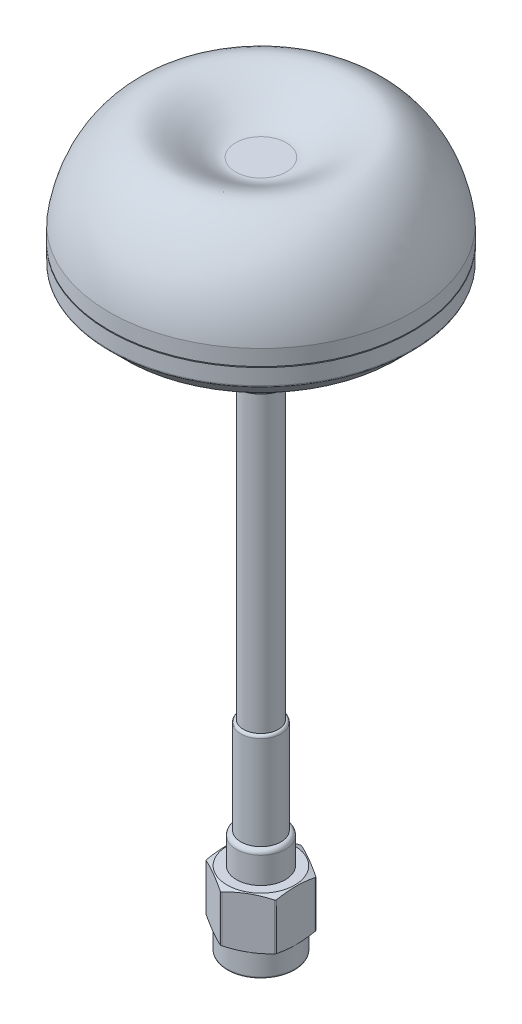
from build123d import *

# Parameters (mm, degrees)
SKETCH1_R           = 3.88
BOSS_EXTRUDE1_DEPTH = 2.6
BOSS_EXTRUDE2_DEPTH = 5.9
SKETCH3_R           = 3.25
CUT_EXTRUDE1_DEPTH  = 1
SKETCH4_R           = 2.85
SKETCH4_R_2         = 0.475
CUT_EXTRUDE2_DEPTH  = 2.45
SKETCH5_R           = 2.85
SKETCH5_R_2         = 2.6
CUT_EXTRUDE3_DEPTH  = 4
SKETCH6_R           = 2.5
SKETCH6_R_2         = 0.475
CUT_EXTRUDE4_DEPTH  = 0.1
THREAD1_PITCH       = 1
CHAMFER1_SIZE       = 1
CHAMFER1_SIZE2      = 0.363970234
FILLET1_R           = 0.2
SKETCH11_R          = 2.8
BOSS_EXTRUDE3_DEPTH = 3.5
SKETCH12_R          = 2.3
BOSS_EXTRUDE4_DEPTH = 11
SKETCH13_R          = 2
BOSS_EXTRUDE6_DEPTH = 34.5
FILLET2_R           = 0.5
FILLET3_R           = 0.3
FILLET4_R           = 3
FILLET5_R           = 0.25
SKETCH16_W          = 0.2
SKETCH16_H          = 0.1


# Some blends are built 0.0001 mm under size
with BuildPart() as part:
    # Sketch1 → Boss-Extrude1 (new body)
    with BuildSketch(Plane(origin=(0, 0, 0), x_dir=(1, 0, 0), z_dir=(0, 1, 0))):
        with Locations(Location((0, 0, 0), (0, 0, 270))):
            Circle(SKETCH1_R)
    extrude(amount=BOSS_EXTRUDE1_DEPTH)

    # Sketch2 → Boss-Extrude2 (add)
    with BuildSketch(Plane(origin=(0, 2.6, 0), x_dir=(1, 0, 0), z_dir=(0, 1, 0))):
        Polygon((0, -4.618802154), (4, -2.309401077), (4, 2.309401077), (0, 4.618802154), (-4, 2.309401077), (-4, -2.309401077), align=None)
    extrude(amount=BOSS_EXTRUDE2_DEPTH)

    # Sketch3 → Cut-Extrude1 (cut)
    with BuildSketch(Plane.XZ):
        with Locations(Location((0, 0, 0), (0, 0, 270))):
            Circle(SKETCH3_R)
    extrude(amount=-CUT_EXTRUDE1_DEPTH, mode=Mode.SUBTRACT)

    # Sketch4 → Cut-Extrude2 (cut)
    with BuildSketch(Plane.XZ.offset(-1)):
        with Locations(Location((0, 0, 0), (0, 0, 270))):
            Circle(SKETCH4_R)
        with Locations(Location((0, 0, 0), (0, 0, 270))):
            Circle(SKETCH4_R_2, mode=Mode.SUBTRACT)
    extrude(amount=-CUT_EXTRUDE2_DEPTH, mode=Mode.SUBTRACT)

    # Sketch5 → Cut-Extrude3 (cut)
    with BuildSketch(Plane.XZ.offset(-3.45)):
        with Locations(Location((0, 0, 0), (0, 0, 270))):
            Circle(SKETCH5_R)
        with Locations(Location((0, 0, 0), (0, 0, 270))):
            Circle(SKETCH5_R_2, mode=Mode.SUBTRACT)
    extrude(amount=-CUT_EXTRUDE3_DEPTH, mode=Mode.SUBTRACT)

    # Sketch6 → Cut-Extrude4 (cut)
    with BuildSketch(Plane.XZ.offset(-3.45)):
        with Locations(Location((0, 0, 0), (0, 0, 270))):
            Circle(SKETCH6_R)
        with Locations(Location((0, 0, 0), (0, 0, 270))):
            Circle(SKETCH6_R_2, mode=Mode.SUBTRACT)
    extrude(amount=-CUT_EXTRUDE4_DEPTH, mode=Mode.SUBTRACT)

    # Thread1: the profile of Thread Profile1 profile screwed along a right-hand helix of 7.45 turns, 8 arcs to a turn; built about Z, then put on its axis
    thread1_z = Axis((0, 0, 0), (0, 0, 1))
    thread1_corners = [(2.8497, 0, -0.000173205), (3.391265875, 0, 0.312499999), (3.391265875, 0, 0.437499999), (2.8497, 0, 0.750173202)]
    with BuildLine(mode=Mode.PRIVATE) as thread1_profile:
        Line(thread1_corners[0], thread1_corners[1])
        Line(thread1_corners[1], thread1_corners[2])
        Line(thread1_corners[2], thread1_corners[3])
        Line(thread1_corners[3], thread1_corners[0])
    thread1_cap = Face(thread1_profile.wire())
    thread1_turn_angles = [0, 22.5, 45, 67.5, 90, 112.5, 135, 157.5, 180, 202.5, 225, 247.5, 270, 292.5, 315, 337.5, 360]
    thread1_turn_weights = [1, 0.9238795325112867, 1, 0.9238795325112867, 1, 0.9238795325112867, 1, 0.9238795325112867, 1, 0.9238795325112867, 1, 0.9238795325112867, 1, 0.9238795325112867, 1, 0.9238795325112867, 1]
    thread1_turn_rails = [Edge.make_bspline([Vector(p[0], p[1], 0).rotate(thread1_z, thread1_turn_angles[k]) / thread1_turn_weights[k] + Vector(0, 0, p[2] + THREAD1_PITCH * thread1_turn_angles[k] / 360) for k in range(17)], [0, 0, 0, 1, 1, 2, 2, 3, 3, 4, 4, 5, 5, 6, 6, 7, 7, 8, 8, 8], 2, thread1_turn_weights) for p in thread1_corners]
    thread1_turn_sides = [Face.make_surface_from_curves(thread1_turn_rails[p[0]], thread1_turn_rails[p[1]]) for p in [(0, 1), (1, 2), (2, 3), (3, 0)]]
    thread1_last_angles = [2520, 2542.5, 2565, 2587.5, 2610, 2632.5, 2655, 2668.5, 2682]
    thread1_last_weights = [1, 0.9238795325112867, 1, 0.9238795325112867, 1, 0.9238795325112867, 1, 0.9723699203976766, 1]
    thread1_last_rails = [Edge.make_bspline([Vector(p[0], p[1], 0).rotate(thread1_z, thread1_last_angles[k]) / thread1_last_weights[k] + Vector(0, 0, p[2] + THREAD1_PITCH * thread1_last_angles[k] / 360) for k in range(9)], [0, 0, 0, 1, 1, 2, 2, 3, 3, 4, 4, 4], 2, thread1_last_weights) for p in thread1_corners]
    thread1_last_sides = [Face.make_surface_from_curves(thread1_last_rails[p[0]], thread1_last_rails[p[1]]) for p in [(0, 1), (1, 2), (2, 3), (3, 0)]]
    thread1 = Plane(origin=(0, 0, 0), x_dir=(1, 0, 0), z_dir=(0, 1, 0)) * Solid(Shell([*[p.moved(Location((0, 0, THREAD1_PITCH * i))) for i in range(7) for p in thread1_turn_sides], *thread1_last_sides, thread1_cap, thread1_cap.rotate(thread1_z, 2682).moved(Location((0, 0, THREAD1_PITCH * 2682 / 360)))]))
    add(thread1, mode=Mode.SUBTRACT)

    # Chamfer1
    chamfer1_edges = [part.edges().sort_by_distance(p)[0] for p in [
        (0, 1, 0.475),
    ]]
    chamfer1_side = [part.faces().sort_by_distance(p)[0] for p in [
        (0, 2.275, 0.475),
    ]]
    chamfer(chamfer1_edges, length=CHAMFER1_SIZE, length2=CHAMFER1_SIZE2, reference=chamfer1_side[0])

    # Sketch10 → Cut-Revolve1 (revolve, cut)
    with BuildSketch(Plane(origin=(0, 0, 0), x_dir=(0.8660254037844387, 0, 0.4999999999999999), z_dir=(-0.4999999999999999, 0, 0.8660254037844387)), mode=Mode.PRIVATE) as cut_revolve1_sk:
        Polygon((-3.868802154, 8.5), (-4.618802154, 8.2), (-4.618802154, 8.5), align=None)
        Polygon((-4.618802154, 2.9), (-4.618802154, 2.6), (-3.868802154, 2.6), align=None)
    revolve(cut_revolve1_sk.sketch.rotate(Axis((0, 2.6, 0), (0, -1, 0)), 60), axis=Axis((0, 2.6, 0), (0, -1, 0)), mode=Mode.SUBTRACT)

    # Fillet1
    # the kernel refuses this fillet: 0.2 mm, written as the material it takes off along each edge
    with BuildSketch(Plane(origin=(4, 2.611324865, -2.309401077), x_dir=(-0.8660254037844374, 0, -0.5000000000000021), z_dir=(0, 1, 0)), Plane(origin=(-4, 2.611324865, -2.309401077), x_dir=(0, 0, 1), z_dir=(0, 1, 0)), Plane(origin=(4, 2.611324865, 2.309401077), x_dir=(0, 0, -1), z_dir=(0, 1, 0)), Plane(origin=(0, 2.611324865, 4.618802154), x_dir=(0.8660254037844397, 0, -0.49999999999999806), z_dir=(0, 1, 0)), Plane(origin=(-4, 2.611324865, 2.309401077), x_dir=(0.8660254037844374, 0, 0.5000000000000021), z_dir=(0, 1, 0))) as fillet1_piece_1:
        with BuildLine():
            CenterArc((FILLET1_R * 0.57735026919, FILLET1_R), FILLET1_R, 210, 60)
            Line((-FILLET1_R * 0.288675134595, FILLET1_R * 0.5), (0, 0))
            Line((0, 0), (FILLET1_R * 0.57735026919, 0))
        make_face()
    extrude(amount=5.877350269, mode=Mode.SUBTRACT)
    with BuildSketch(Plane(origin=(0, 2.611324865, -4.618802154), x_dir=(0.8660254037844368, 0, 0.5000000000000033), z_dir=(0, 1, 0))) as fillet1_piece_2:
        with BuildLine():
            CenterArc((FILLET1_R * 0.57735026919, -FILLET1_R), FILLET1_R, 90, 60)
            Line((-FILLET1_R * 0.288675134595, -FILLET1_R * 0.5), (0, 0))
            Line((0, 0), (FILLET1_R * 0.57735026919, 0))
        make_face()
    extrude(amount=5.877350269, mode=Mode.SUBTRACT)
    with BuildSketch(Plane(origin=(0, 0, 0), x_dir=(0, 0, -1), z_dir=(-1, 0, 0))) as fillet1_piece_3:
        with BuildLine():
            CenterArc((3.25 + FILLET1_R, -FILLET1_R), FILLET1_R, 90, 90)
            Line((3.25 + FILLET1_R, 0), (3.25, 0))
            Line((3.25, 0), (3.25, -FILLET1_R))
        make_face()
    revolve(axis=Axis((0, 0, 0), (0, -1, 0)), mode=Mode.SUBTRACT)
    with BuildSketch(Plane(origin=(0, 0, 0), x_dir=(0, 0, 1), z_dir=(-1, 0, 0))) as fillet1_piece_4:
        with BuildLine():
            CenterArc((3.88 - FILLET1_R, FILLET1_R), FILLET1_R, 270, 90)
            Line((3.88, FILLET1_R), (3.88, 0))
            Line((3.88, 0), (3.88 - FILLET1_R, 0))
        make_face()
    revolve(axis=Axis((0, 0, 0), (0, 1, 0)), mode=Mode.SUBTRACT)

    # Sketch11 → Boss-Extrude3 (add)
    with BuildSketch(Plane(origin=(0, 8.5, 0), x_dir=(1, 0, 0), z_dir=(0, 1, 0))):
        with Locations(Location((0, 0, 0), (0, 0, 270))):
            Circle(SKETCH11_R)
    extrude(amount=BOSS_EXTRUDE3_DEPTH)

    # Sketch12 → Boss-Extrude4 (add)
    with BuildSketch(Plane(origin=(0, 12, 0), x_dir=(1, 0, 0), z_dir=(0, 1, 0))):
        with Locations(Location((0, 0, 0), (0, 0, 270))):
            Circle(SKETCH12_R)
    extrude(amount=BOSS_EXTRUDE4_DEPTH)

    # Sketch13 → Boss-Extrude6 (add)
    with BuildSketch(Plane(origin=(0, 23, 0), x_dir=(1, 0, 0), z_dir=(0, 1, 0))):
        with Locations(Location((0, 0, 0), (0, 0, 270))):
            Circle(SKETCH13_R)
    extrude(amount=BOSS_EXTRUDE6_DEPTH)

    # Fillet2
    fillet2_edges = [part.edges().sort_by_distance(p)[0] for p in [
        (0, 12, -2.8),
    ]]
    fillet(fillet2_edges, radius=FILLET2_R - 0.0001)  # a hair under: the kernel refuses the full size

    # Fillet3
    fillet3_edges = [part.edges().sort_by_distance(p)[0] for p in [
        (0, 23, -2.3),
    ]]
    fillet(fillet3_edges, radius=FILLET3_R - 0.0001)  # a hair under: the kernel refuses the full size

    # Sketch15 → Revolve1 (revolve)
    with BuildSketch(Plane.XY, mode=Mode.PRIVATE) as revolve1_sk:
        with BuildLine():
            Line((-2, 57.5), (-3.375, 57.5))
            Line((-3.375, 57.5), (-3.375, 66.22))
            Line((-3.375, 66.22), (-15.35, 66.22))
            Line((-15.35, 66.22), (-17.35, 68.22))
            Line((-17.35, 68.22), (-17.35, 72.02))
            add(Edge.make_bspline(
                [(-2.9, 78.7), (-4.483232716, 78.661603847), (-7.185936497, 81.482706773), (-12.03187703, 82.099364655), (-16.570096031, 77.928582535), (-17.35, 72.02)],
                knots=[0, 0, 0, 0, 0.507969022, 0.607969022, 1, 1, 1, 1], degree=3))
            Line((-2.9, 78.7), (0, 78.7))
            Line((0, 78.7), (0, 57.5))
            Line((0, 57.5), (-2, 57.5))
        make_face()
    revolve(revolve1_sk.sketch.rotate(Axis((0, 2.6, 0), (0, -1, 0)), 270), axis=Axis((0, 2.6, 0), (0, -1, 0)))

    # Fillet4
    fillet4_edges = [part.edges().sort_by_distance(p)[0] for p in [
        (0, 66.22, -3.375),
    ]]
    fillet(fillet4_edges, radius=FILLET4_R)

    # Fillet5
    fillet5_edges = [part.edges().sort_by_distance(p)[0] for p in [
        (0, 68.22, -17.35),
        (0, 66.22, -15.35),
        (0, 57.5, -3.375),
    ]]
    fillet(fillet5_edges, radius=FILLET5_R)

    # Sketch16 → Cut-Revolve2 (revolve, cut)
    with BuildSketch(Plane.XY, mode=Mode.PRIVATE) as cut_revolve2_sk:
        with Locations((-17.25, 70.171776695)):
            Rectangle(SKETCH16_W, SKETCH16_H)
    revolve(cut_revolve2_sk.sketch.rotate(Axis((0, 2.6, 0), (0, -1, 0)), 270), axis=Axis((0, 2.6, 0), (0, -1, 0)), mode=Mode.SUBTRACT)


solid = part.part
